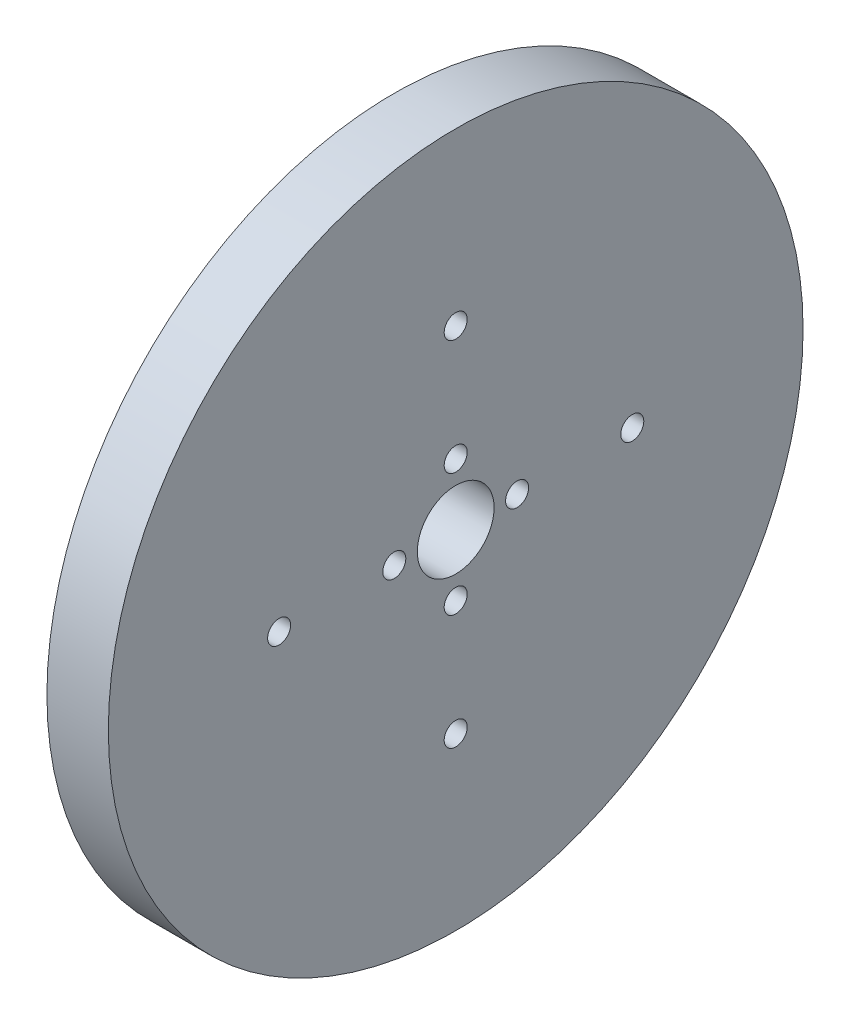
from build123d import *

# Parameters (mm, degrees)
SPROCKET_R                   = 45.25
ESTRUSIONE_ESTRUSIONE2_DEPTH = 8
SCHIZZO1_R                   = 5
SCHIZZO1_R_2                 = 1.5
TAGLIO_ESTRUSIONE2_DEPTH     = 65.49127848


with BuildPart() as part:
    # Sprocket → Estrusione-Estrusione2 (new body)
    with BuildSketch(Plane(origin=(0, 0, 0), x_dir=(0, 0, -1), z_dir=(1, 0, 0))):
        Circle(SPROCKET_R)
    extrude(amount=ESTRUSIONE_ESTRUSIONE2_DEPTH)

    # Schizzo1 → Taglio-Estrusione2 (cut, through all)
    with BuildSketch(Plane(origin=(0, 0, 0), x_dir=(0, 0, -1), z_dir=(1, 0, 0))):
        Circle(SCHIZZO1_R)
        with Locations((0, 23)):
            Circle(SCHIZZO1_R_2)
        with Locations((8, 0)):
            Circle(SCHIZZO1_R_2)
        with Locations((0, 8)):
            Circle(SCHIZZO1_R_2)
        with Locations((23, 0)):
            Circle(SCHIZZO1_R_2)
        with Locations((0, -8)):
            Circle(SCHIZZO1_R_2)
        with Locations((0, -23)):
            Circle(SCHIZZO1_R_2)
        with Locations((-8, 0)):
            Circle(SCHIZZO1_R_2)
        with Locations((-23, 0)):
            Circle(SCHIZZO1_R_2)
    extrude(amount=TAGLIO_ESTRUSIONE2_DEPTH, mode=Mode.SUBTRACT)


solid = part.part
